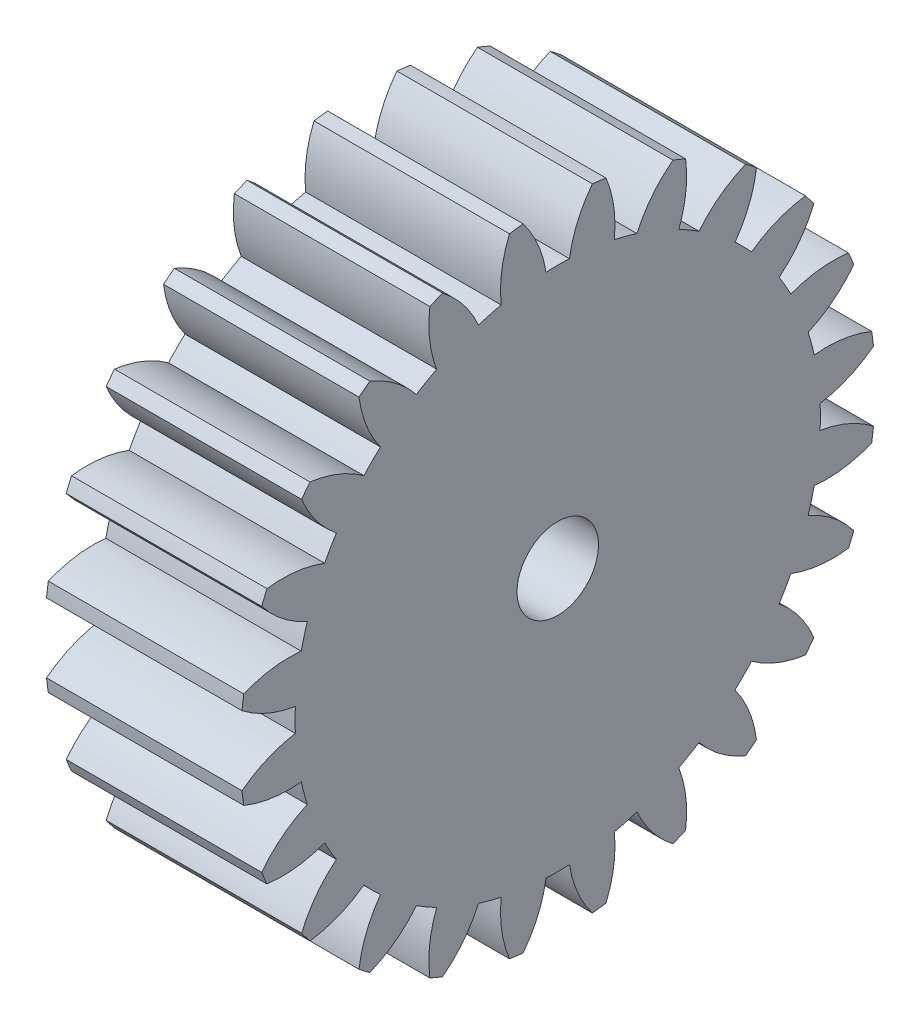
from build123d import *

# Parameters (mm, degrees)
BASPROSKE_W         = 12
BASPROSKE_H         = 19.5
TOOTHCUT_DEPTH      = 31.074906484
TEETHCUTS_COUNT     = 24
TEETHCUTS_ANGLE     = 345
BORSKE_R            = 2.5
BORE_DEPTH          = 50.0000508
BOSS_EXTRUDE1_START = -10
BOSS_EXTRUDE1_DEPTH = 10


with BuildPart() as part:
    # BasProSke → Base-Revolve (revolve)
    with BuildSketch(Plane(origin=(0, 0, 0), x_dir=(1, 0, 0), z_dir=(0, 1, 0))):
        with Locations((6, 9.75)):
            Rectangle(BASPROSKE_W, BASPROSKE_H)
    revolve(axis=Axis((-10, 0, 0), (1, 0, 0)))

    # TooCutSke → ToothCut (cut, through all)
    with BuildSketch(Plane(origin=(0, 0, 0), x_dir=(0, 0, -1), z_dir=(1, 0, 0))):
        with BuildLine():
            ThreePointArc((0.718975251, 16.107962335), (0, 16.124), (-0.718975251, 16.107962335))
            ThreePointArc((-0.718975251, 16.107962335), (-1.222639001, 17.848001425), (-2.144665446, 19.407257799))
            ThreePointArc((-2.144665446, 19.407257799), (0, 19.5254), (2.144665446, 19.407257799))
            ThreePointArc((2.144665446, 19.407257799), (1.222639001, 17.848001425), (0.718975251, 16.107962335))
        make_face()
    toothcut = extrude(amount=TOOTHCUT_DEPTH, mode=Mode.SUBTRACT)

    # TeethCuts: ToothCut ×24 about axis
    teethcuts_axis = Axis((-10, 0, 0), (1, 0, 0))
    for i in range(1, TEETHCUTS_COUNT):
        add(toothcut.rotate(teethcuts_axis, i * TEETHCUTS_ANGLE / (TEETHCUTS_COUNT - 1)), mode=Mode.SUBTRACT)

    # BorSke → Bore (cut, symmetric)
    with BuildSketch(Plane(origin=(0, 0, 0), x_dir=(0, 0, -1), z_dir=(1, 0, 0))):
        Circle(BORSKE_R)
    extrude(amount=BORE_DEPTH, both=True, mode=Mode.SUBTRACT)

    # Sketch1 → Boss-Extrude1 (add)
    with BuildSketch(Plane.ZY.offset(BOSS_EXTRUDE1_START)):
        with BuildLine():
            ThreePointArc((2, 1.5), (0, 2.5), (-2, 1.5))
            Line((-2, 1.5), (2, 1.5))
        make_face()
    extrude(amount=BOSS_EXTRUDE1_DEPTH)


solid = part.part
